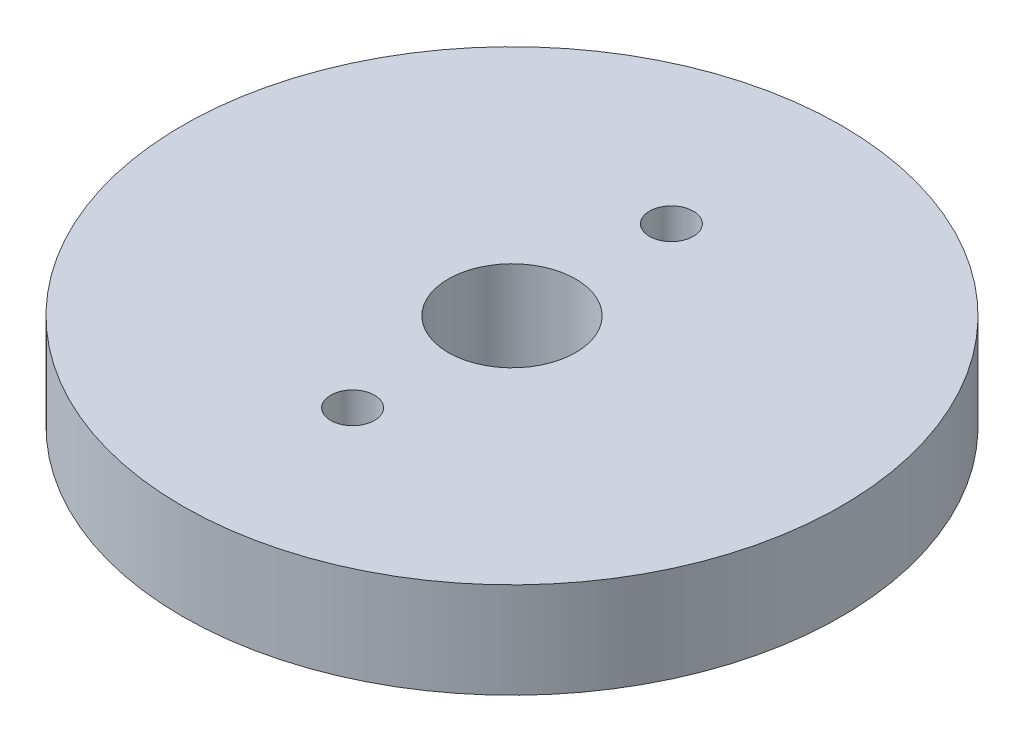
from build123d import *

# Parameters (mm, degrees)
SKETCH1_R           = 41.35
BOSS_EXTRUDE1_DEPTH = 12
SKETCH2_R           = 2.75
CUT_EXTRUDE1_DEPTH  = 25
SKETCH4_R           = 8
CUT_EXTRUDE2_DEPTH  = 25


with BuildPart() as part:
    # Sketch1 → Boss-Extrude1 (new body)
    with BuildSketch(Plane(origin=(0, 0, 0), x_dir=(1, 0, 0), z_dir=(0, 1, 0))):
        Circle(SKETCH1_R)
    extrude(amount=BOSS_EXTRUDE1_DEPTH)

    # Sketch2 → Cut-Extrude1 (cut)
    with BuildSketch(Plane(origin=(0, 12, 0), x_dir=(1, 0, 0), z_dir=(0, 1, 0))):
        with Locations((0, 20)):
            Circle(SKETCH2_R)
        with Locations((0, -20)):
            Circle(SKETCH2_R)
    extrude(amount=-CUT_EXTRUDE1_DEPTH, mode=Mode.SUBTRACT)

    # Sketch4 → Cut-Extrude2 (cut)
    with BuildSketch(Plane(origin=(0, 12, 0), x_dir=(1, 0, 0), z_dir=(0, 1, 0))):
        Circle(SKETCH4_R)
    extrude(amount=-CUT_EXTRUDE2_DEPTH, mode=Mode.SUBTRACT)


solid = part.part
